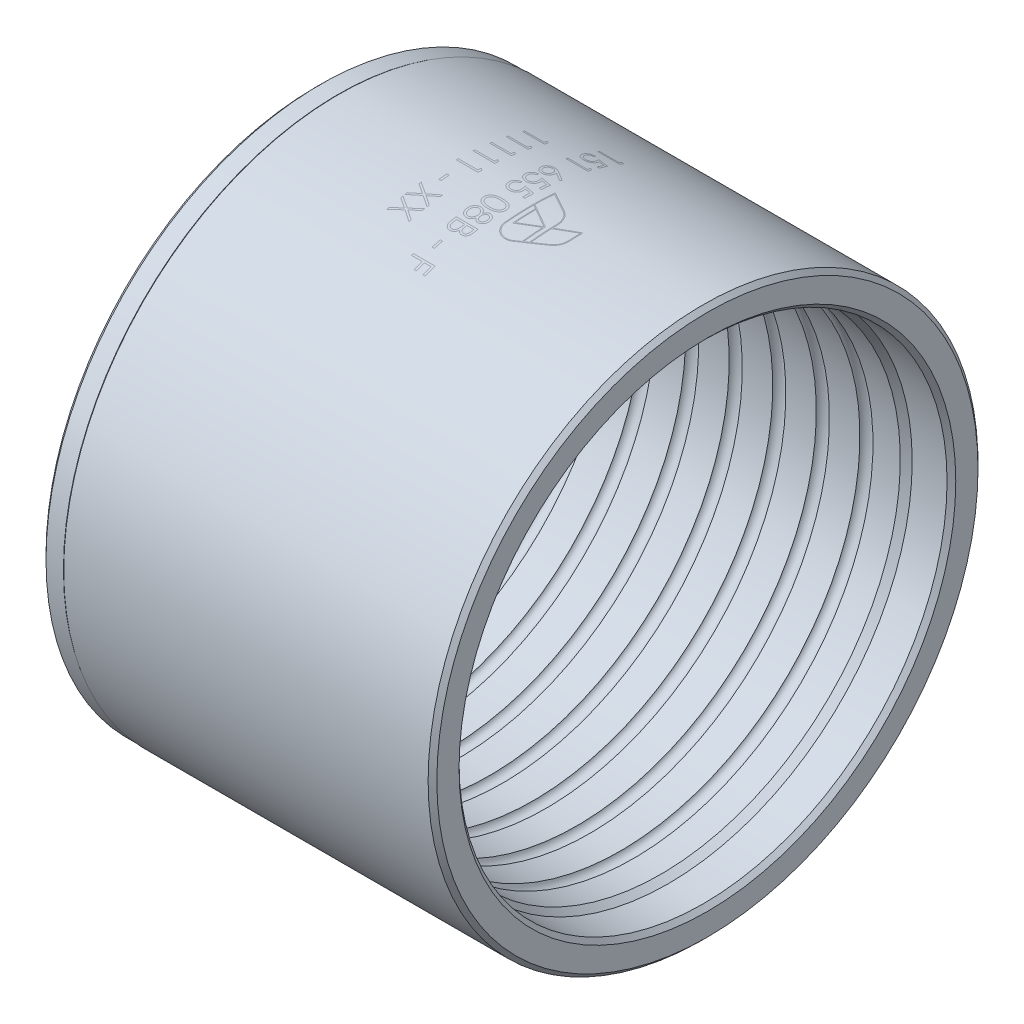
from build123d import *

# Parameters (mm, degrees)
CHAMFER2_SIZE  = 0.5
CHAMFER3_SIZE  = 2.5
CHAMFER3_SIZE2 = 0.909925586


with BuildPart() as part:
    # Sketch1 → Revolve1 (revolve)
    with BuildSketch(Plane.XY):
        with BuildLine():
            Line((0, 27.5), (0, 31.5))
            Line((0, 31.5), (2.5, 31.5))
            Line((2.5, 31.5), (2.58660254, 31.55))
            Line((2.58660254, 31.55), (44.9, 31.55))
            Line((44.9, 31.55), (44.9, 28))
            Line((44.9, 28), (40.4, 28))
            Line((40.4, 28), (39.533974596, 27.5))
            Line((39.533974596, 27.5), (36.4, 27.5))
            ThreePointArc((36.4, 27.5), (35.65, 28), (34.9, 27.5))
            Line((34.9, 27.5), (31.4, 27.5))
            ThreePointArc((31.4, 27.5), (30.65, 28), (29.9, 27.5))
            Line((29.9, 27.5), (26.4, 27.5))
            ThreePointArc((26.4, 27.5), (25.65, 28), (24.9, 27.5))
            Line((24.9, 27.5), (21.4, 27.5))
            ThreePointArc((21.4, 27.5), (20.65, 28), (19.9, 27.5))
            Line((19.9, 27.5), (16.4, 27.5))
            ThreePointArc((16.4, 27.5), (15.65, 28), (14.9, 27.5))
            Line((14.9, 27.5), (11.4, 27.5))
            ThreePointArc((11.4, 27.5), (10.65, 28), (9.9, 27.5))
            Line((9.9, 27.5), (6.4, 27.5))
            ThreePointArc((6.4, 27.5), (5.65, 28), (4.9, 27.5))
            Line((4.9, 27.5), (0, 27.5))
        make_face()
    revolve(axis=Axis((0, 0, 0), (1, 0, 0)))

    # Chamfer2
    chamfer2_edges = [part.edges().sort_by_distance(p)[0] for p in [
        (44.9, -31.55, 0),
        (44.9, -28, 0),
        (0, -31.5, 0),
    ]]
    chamfer(chamfer2_edges, length=CHAMFER2_SIZE)

    # Chamfer3
    chamfer3_edges = [part.edges().sort_by_distance(p)[0] for p in [
        (0, -27.5, 0),
    ]]
    chamfer3_side = [part.faces().sort_by_distance(p)[0] for p in [
        (2.45, -27.5, 0),
    ]]
    chamfer(chamfer3_edges, length=CHAMFER3_SIZE, length2=CHAMFER3_SIZE2, reference=chamfer3_side[0])


solid = part.part
